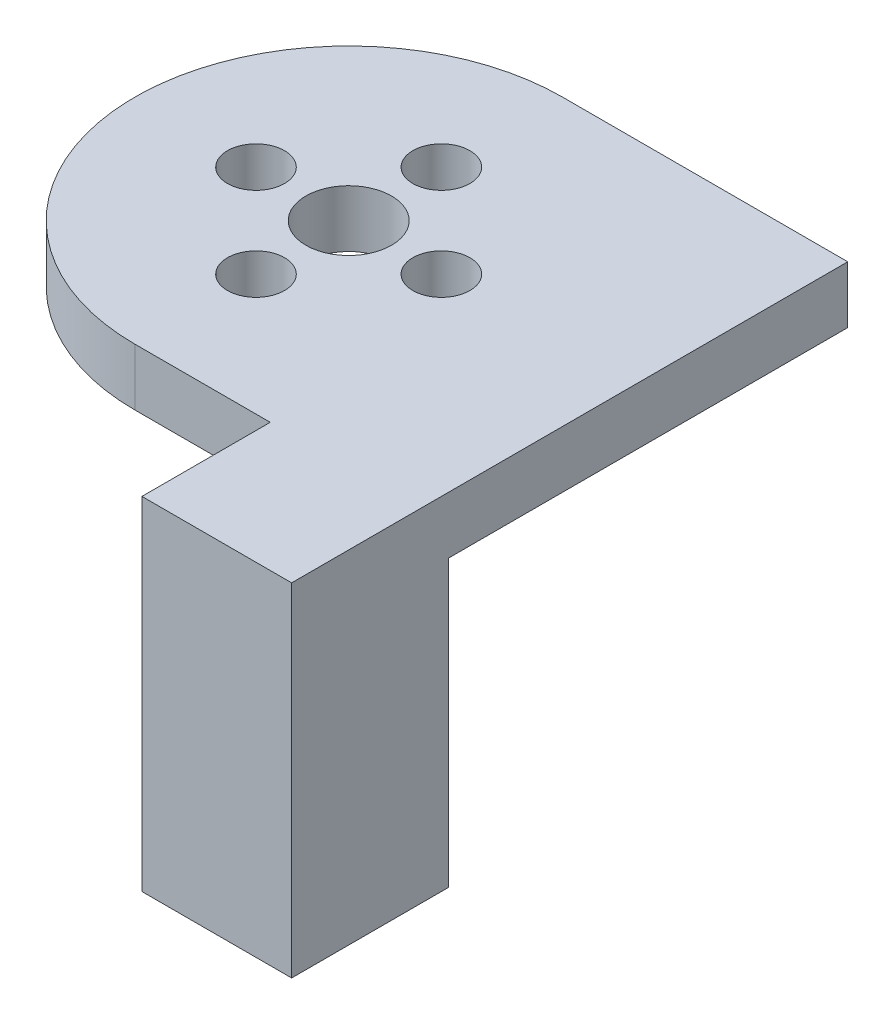
from build123d import *

# Parameters (mm, degrees)
SKETCH1_R           = 3
SKETCH1_R_2         = 2
BOSS_EXTRUDE1_DEPTH = 4
SKETCH5_W           = 10.5
SKETCH5_H           = 4
BOSS_EXTRUDE3_DEPTH = 9
SKETCH6_W           = 10.5
SKETCH6_H           = 3
BOSS_EXTRUDE4_DEPTH = 20
BOSS_EXTRUDE5_DEPTH = 20


with BuildPart() as part:
    # Sketch1 → Boss-Extrude1 (new body)
    with BuildSketch(Plane(origin=(0, 0, 0), x_dir=(1, 0, 0), z_dir=(0, 1, 0))):
        with BuildLine():
            Line((10, -15), (-10, -15))
            ThreePointArc((-10, -15), (-25, 0), (-10, 15))
            Line((-10, 15), (10, 15))
            Line((10, 15), (10, -15))
        make_face()
        with Locations((-10, 0)):
            Circle(SKETCH1_R, mode=Mode.SUBTRACT)
        with Locations((-10, 6.5)):
            Circle(SKETCH1_R_2, mode=Mode.SUBTRACT)
        with Locations((-3.5, 0)):
            Circle(SKETCH1_R_2, mode=Mode.SUBTRACT)
        with Locations((-10, -6.5)):
            Circle(SKETCH1_R_2, mode=Mode.SUBTRACT)
        with Locations((-16.5, 0)):
            Circle(SKETCH1_R_2, mode=Mode.SUBTRACT)
    extrude(amount=BOSS_EXTRUDE1_DEPTH)

    # Sketch5 → Boss-Extrude3 (add)
    with BuildSketch(Plane.XY.offset(15)):
        with Locations((4.75, 2)):
            Rectangle(SKETCH5_W, SKETCH5_H)
    extrude(amount=BOSS_EXTRUDE3_DEPTH)

    # Sketch6 → Boss-Extrude4 (add)
    with BuildSketch(Plane(origin=(0, 0, 0), x_dir=(-1, 0, 0), z_dir=(0, -1, 0))):
        with Locations((-4.75, -22.5)):
            Rectangle(SKETCH6_W, SKETCH6_H)
    extrude(amount=BOSS_EXTRUDE4_DEPTH)

    # Sketch7 → Boss-Extrude5 (add)
    with BuildSketch(Plane(origin=(0, 0, 0), x_dir=(-1, 0, 0), z_dir=(0, -1, 0))):
        Polygon((-10, -21), (-6.7, -21), (-7, -13), (-10, -13), align=None)
    extrude(amount=BOSS_EXTRUDE5_DEPTH)


solid = part.part
